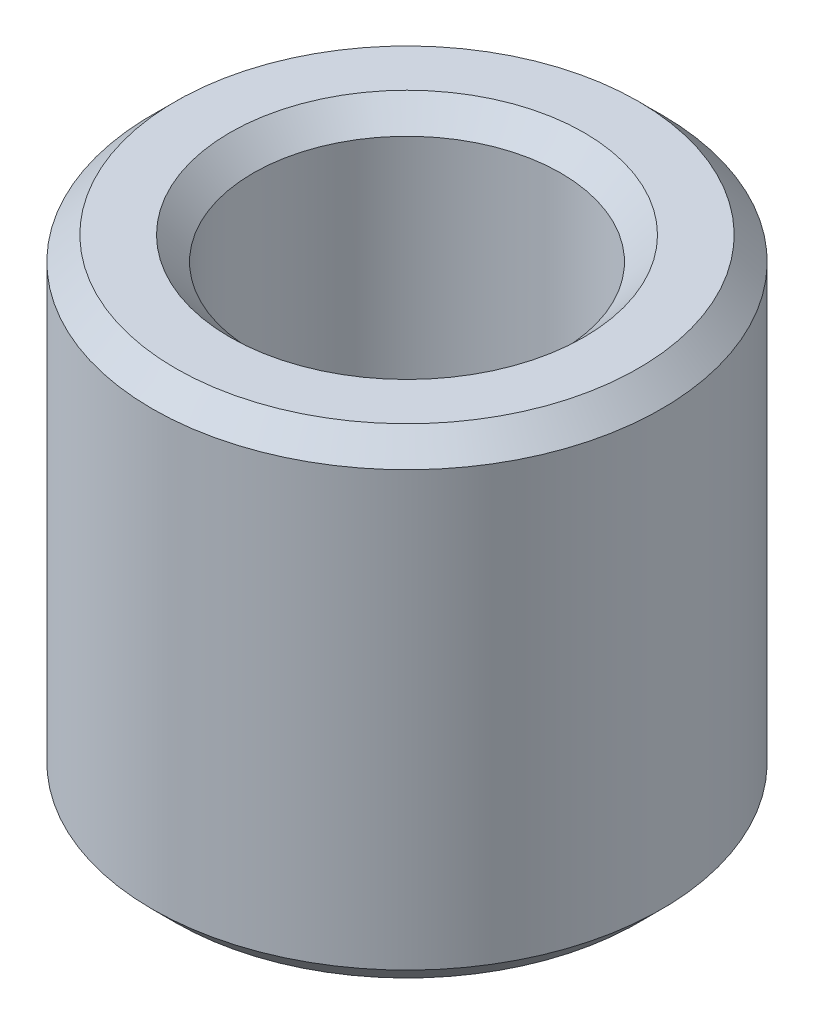
from build123d import *

# Parameters (mm, degrees)
SKETCH1_R           = 20
BOSS_EXTRUDE1_DEPTH = 37.694463778
SKETCH2_R           = 12.077262797
CUT_EXTRUDE1_DEPTH  = 48.126134994
CHAMFER1_SIZE       = 1.832947838


with BuildPart() as part:
    # Sketch1 → Boss-Extrude1 (new body)
    with BuildSketch(Plane(origin=(0, 0, 0), x_dir=(1, 0, 0), z_dir=(0, 1, 0))):
        Circle(SKETCH1_R)
    extrude(amount=BOSS_EXTRUDE1_DEPTH)

    # Sketch2 → Cut-Extrude1 (cut, through all)
    with BuildSketch(Plane(origin=(0, 0, 0), x_dir=(1, 0, 0), z_dir=(0, 1, 0))):
        Circle(SKETCH2_R)
    extrude(amount=CUT_EXTRUDE1_DEPTH, mode=Mode.SUBTRACT)

    # Chamfer1
    chamfer1_edges = [part.edges().sort_by_distance(p)[0] for p in [
        (-12.077262797, 37.694463778, 0),
        (-12.077262797, 0, 0),
        (-20, 0, 0),
        (-20, 37.694463778, 0),
    ]]
    chamfer(chamfer1_edges, length=CHAMFER1_SIZE)


solid = part.part
